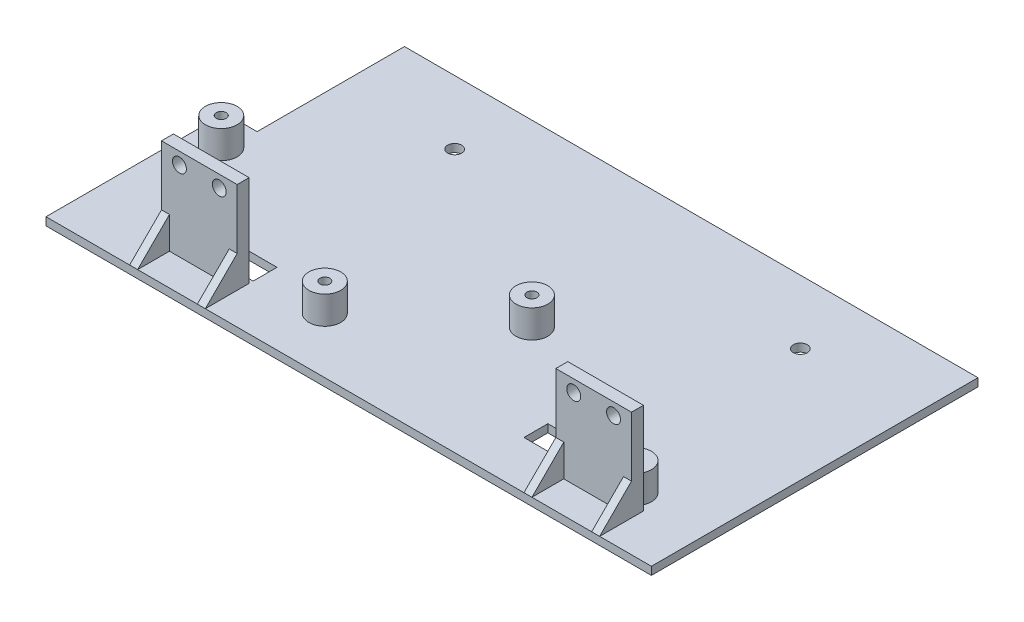
from build123d import *

# Parameters (mm, degrees)
CROQUIS1_W              = 144
CROQUIS1_H              = 82
SALIENTE_EXTRUIR1_DEPTH = 2
CROQUIS3_W              = 8
CROQUIS3_H              = 45
SALIENTE_EXTRUIR2_DEPTH = 2
CROQUIS2_R              = 4
CROQUIS2_R_2            = 1.25
SALIENTE_EXTRUIR3_DEPTH = 7
CORTAR_EXTRUIR1_REACH   = 92.167
CROQUIS4_W              = 19
CROQUIS4_H              = 6
CORTAR_EXTRUIR2_REACH   = 92.167
CROQUIS5_R              = 1.75
CROQUIS7_W              = 19
CROQUIS7_H              = 3
SALIENTE_EXTRUIR4_DEPTH = 23
CORTAR_EXTRUIR3_REACH   = 113.808
CROQUIS9_R              = 1.75
NERVIO1_REACH           = 141.524
CROQUIS10_WALL_W        = 292.3620914
CROQUIS10_WALL_H        = 2
NERVIO2_REACH           = 123.861
CROQUIS11_WALL_W        = 257.034860638
CROQUIS11_WALL_H        = 2
NERVIO3_REACH           = 149.061
CROQUIS12_WALL_W        = 307.43613199
CROQUIS12_WALL_H        = 2
NERVIO4_REACH           = 131.252
CROQUIS13_WALL_W        = 271.81709339
CROQUIS13_WALL_H        = 2


with BuildPart() as part:
    # Croquis1 → Saliente-Extruir1 (new body)
    with BuildSketch(Plane(origin=(0, 0, 0), x_dir=(1, 0, 0), z_dir=(0, 1, 0))):
        Rectangle(CROQUIS1_W, CROQUIS1_H)
    extrude(amount=SALIENTE_EXTRUIR1_DEPTH)

    # Croquis3 → Saliente-Extruir2 (add)
    with BuildSketch(Plane(origin=(0, 2, 0), x_dir=(1, 0, 0), z_dir=(0, 1, 0))):
        with Locations((-76, -18.5)):
            Rectangle(CROQUIS3_W, CROQUIS3_H)
    extrude(amount=-SALIENTE_EXTRUIR2_DEPTH)

    # Croquis2 → Saliente-Extruir3 (add)
    # profile 1 of 4: a face of its own
    with BuildSketch(Plane(origin=(0, 2, 0), x_dir=(1, 0, 0), z_dir=(0, 1, 0))):
        with Locations((54, -27)):
            Circle(CROQUIS2_R)
        with Locations((54, -27)):
            Circle(CROQUIS2_R_2, mode=Mode.SUBTRACT)
    # profile 2 of 4: a face of its own
    with BuildSketch(Plane(origin=(0, 2, 0), x_dir=(1, 0, 0), z_dir=(0, 1, 0))):
        with Locations((5, -4)):
            Circle(CROQUIS2_R)
        with Locations((5, -4)):
            Circle(CROQUIS2_R_2, mode=Mode.SUBTRACT)
    # profile 3 of 4: a face of its own
    with BuildSketch(Plane(origin=(0, 2, 0), x_dir=(1, 0, 0), z_dir=(0, 1, 0))):
        with Locations((-24, -27)):
            Circle(CROQUIS2_R)
        with Locations((-24, -27)):
            Circle(CROQUIS2_R_2, mode=Mode.SUBTRACT)
    # profile 4 of 4: a face of its own
    with BuildSketch(Plane(origin=(0, 2, 0), x_dir=(1, 0, 0), z_dir=(0, 1, 0))):
        with Locations((-73, -4)):
            Circle(CROQUIS2_R)
        with Locations((-73, -4)):
            Circle(CROQUIS2_R_2, mode=Mode.SUBTRACT)
    extrude(amount=SALIENTE_EXTRUIR3_DEPTH)

    # Croquis4 → Cortar-Extruir1 (cut, up to next)
    with BuildSketch(Plane(origin=(0, 2, 0), x_dir=(1, 0, 0), z_dir=(0, 1, 0)), mode=Mode.PRIVATE) as cortar_extruir1_sk1:
        with Locations((-49.5, -26)):
            Rectangle(CROQUIS4_W, CROQUIS4_H)
    cortar_extruir1_tool1 = extrude(cortar_extruir1_sk1.sketch, amount=-CORTAR_EXTRUIR1_REACH, mode=Mode.PRIVATE) & part.part
    # Croquis4 → Cortar-Extruir1 (cut, up to next)
    with BuildSketch(Plane(origin=(0, 2, 0), x_dir=(1, 0, 0), z_dir=(0, 1, 0)), mode=Mode.PRIVATE) as cortar_extruir1_sk2:
        with Locations((37.5, -26)):
            Rectangle(CROQUIS4_W, CROQUIS4_H)
    cortar_extruir1_tool2 = extrude(cortar_extruir1_sk2.sketch, amount=-CORTAR_EXTRUIR1_REACH, mode=Mode.PRIVATE) & part.part
    add(cortar_extruir1_tool1.solids().sort_by_distance((-49.5, 2, 26))[0], mode=Mode.SUBTRACT)
    add(cortar_extruir1_tool2.solids().sort_by_distance((37.5, 2, 26))[0], mode=Mode.SUBTRACT)

    # Croquis5 → Cortar-Extruir2 (cut, up to next)
    with BuildSketch(Plane(origin=(0, 2, 0), x_dir=(1, 0, 0), z_dir=(0, 1, 0)), mode=Mode.PRIVATE) as cortar_extruir2_sk1:
        with Locations((-43.4, 25)):
            Circle(CROQUIS5_R)
    cortar_extruir2_tool1 = extrude(cortar_extruir2_sk1.sketch, amount=-CORTAR_EXTRUIR2_REACH, mode=Mode.PRIVATE) & part.part
    # Croquis5 → Cortar-Extruir2 (cut, up to next)
    with BuildSketch(Plane(origin=(0, 2, 0), x_dir=(1, 0, 0), z_dir=(0, 1, 0)), mode=Mode.PRIVATE) as cortar_extruir2_sk2:
        with Locations((43.4, 25)):
            Circle(CROQUIS5_R)
    cortar_extruir2_tool2 = extrude(cortar_extruir2_sk2.sketch, amount=-CORTAR_EXTRUIR2_REACH, mode=Mode.PRIVATE) & part.part
    add(cortar_extruir2_tool1.solids().sort_by_distance((-43.4, 2, -25))[0], mode=Mode.SUBTRACT)
    add(cortar_extruir2_tool2.solids().sort_by_distance((43.4, 2, -25))[0], mode=Mode.SUBTRACT)

    # Croquis7 → Saliente-Extruir4 (add)
    with BuildSketch(Plane(origin=(0, 2, 0), x_dir=(1, 0, 0), z_dir=(0, 1, 0))):
        with Locations((-49.5, -31.5)):
            Rectangle(CROQUIS7_W, CROQUIS7_H)
        with Locations((49.5, -31.5)):
            Rectangle(CROQUIS7_W, CROQUIS7_H)
    extrude(amount=SALIENTE_EXTRUIR4_DEPTH)

    # Croquis9 → Cortar-Extruir3 (cut, up to next)
    with BuildSketch(Plane.XY.offset(33), mode=Mode.PRIVATE) as cortar_extruir3_sk1:
        with Locations((-54.5, 22)):
            Circle(CROQUIS9_R)
    cortar_extruir3_tool1 = extrude(cortar_extruir3_sk1.sketch, amount=-CORTAR_EXTRUIR3_REACH, mode=Mode.PRIVATE) & part.part
    # Croquis9 → Cortar-Extruir3 (cut, up to next)
    with BuildSketch(Plane.XY.offset(33), mode=Mode.PRIVATE) as cortar_extruir3_sk2:
        with Locations((-44.5, 22)):
            Circle(CROQUIS9_R)
    cortar_extruir3_tool2 = extrude(cortar_extruir3_sk2.sketch, amount=-CORTAR_EXTRUIR3_REACH, mode=Mode.PRIVATE) & part.part
    # Croquis9 → Cortar-Extruir3 (cut, up to next)
    with BuildSketch(Plane.XY.offset(33), mode=Mode.PRIVATE) as cortar_extruir3_sk3:
        with Locations((44.5, 22)):
            Circle(CROQUIS9_R)
    cortar_extruir3_tool3 = extrude(cortar_extruir3_sk3.sketch, amount=-CORTAR_EXTRUIR3_REACH, mode=Mode.PRIVATE) & part.part
    # Croquis9 → Cortar-Extruir3 (cut, up to next)
    with BuildSketch(Plane.XY.offset(33), mode=Mode.PRIVATE) as cortar_extruir3_sk4:
        with Locations((54.5, 22)):
            Circle(CROQUIS9_R)
    cortar_extruir3_tool4 = extrude(cortar_extruir3_sk4.sketch, amount=-CORTAR_EXTRUIR3_REACH, mode=Mode.PRIVATE) & part.part
    add(cortar_extruir3_tool1.solids().sort_by_distance((-54.5, 22, 33))[0], mode=Mode.SUBTRACT)
    add(cortar_extruir3_tool2.solids().sort_by_distance((-44.5, 22, 33))[0], mode=Mode.SUBTRACT)
    add(cortar_extruir3_tool3.solids().sort_by_distance((44.5, 22, 33))[0], mode=Mode.SUBTRACT)
    add(cortar_extruir3_tool4.solids().sort_by_distance((54.5, 22, 33))[0], mode=Mode.SUBTRACT)

    # Croquis10 wall → Nervio1 (add, up to next)
    with BuildSketch(Plane(origin=(-59, 6, 37), x_dir=(0, 0.707106781187, -0.707106781187), z_dir=(0, -0.707106781187, -0.707106781187)), mode=Mode.PRIVATE) as nervio1_sk1:
        with Locations((0, 1)):
            Rectangle(CROQUIS10_WALL_W, CROQUIS10_WALL_H)
    nervio1_tool1 = extrude(nervio1_sk1.sketch, amount=NERVIO1_REACH, mode=Mode.PRIVATE) - part.part
    add(nervio1_tool1.solids().sort_by_distance((-59, 6, 37))[0])

    # Croquis11 wall → Nervio2 (add, up to next)
    with BuildSketch(Plane(origin=(-40, 6, 37), x_dir=(0, 0.707106781187, -0.707106781187), z_dir=(0, 0.707106781187, 0.707106781187)), mode=Mode.PRIVATE) as nervio2_sk1:
        with Locations((0, 1)):
            Rectangle(CROQUIS11_WALL_W, CROQUIS11_WALL_H)
    nervio2_tool1 = extrude(nervio2_sk1.sketch, amount=-NERVIO2_REACH, mode=Mode.PRIVATE) - part.part
    add(nervio2_tool1.solids().sort_by_distance((-40, 6, 37))[0])

    # Croquis12 wall → Nervio3 (add, up to next)
    with BuildSketch(Plane(origin=(59, 6, 37), x_dir=(0, -0.707106781187, 0.707106781187), z_dir=(0, -0.707106781187, -0.707106781187)), mode=Mode.PRIVATE) as nervio3_sk1:
        with Locations((0, 1)):
            Rectangle(CROQUIS12_WALL_W, CROQUIS12_WALL_H)
    nervio3_tool1 = extrude(nervio3_sk1.sketch, amount=NERVIO3_REACH, mode=Mode.PRIVATE) - part.part
    add(nervio3_tool1.solids().sort_by_distance((59, 6, 37))[0])

    # Croquis13 wall → Nervio4 (add, up to next)
    with BuildSketch(Plane(origin=(40, 6, 37), x_dir=(0, -0.707106781187, 0.707106781187), z_dir=(0, 0.707106781187, 0.707106781187)), mode=Mode.PRIVATE) as nervio4_sk1:
        with Locations((0, 1)):
            Rectangle(CROQUIS13_WALL_W, CROQUIS13_WALL_H)
    nervio4_tool1 = extrude(nervio4_sk1.sketch, amount=-NERVIO4_REACH, mode=Mode.PRIVATE) - part.part
    add(nervio4_tool1.solids().sort_by_distance((40, 6, 37))[0])


solid = part.part
